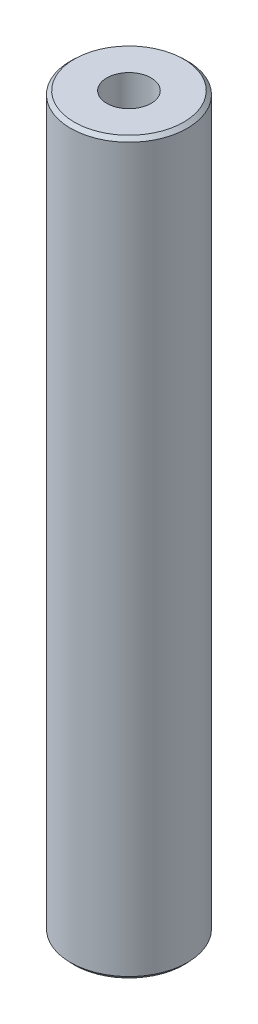
from build123d import *
from OCP.BRepFilletAPI import BRepFilletAPI_MakeChamfer

# Parameters (mm, degrees)
SKETCH1_R           = 47.5
BOSS_EXTRUDE1_DEPTH = 593.664447053
SKETCH2_R           = 18.027375068
CUT_EXTRUDE1_DEPTH  = 598.452906675
CHAMFER1_SIZE       = 2.806428359
CHAMFER1_SIZE2      = 3.017994737


with BuildPart() as part:
    # Sketch1 → Boss-Extrude1 (new body)
    with BuildSketch(Plane(origin=(0, 0, 0), x_dir=(1, 0, 0), z_dir=(0, 1, 0))):
        Circle(SKETCH1_R)
    extrude(amount=BOSS_EXTRUDE1_DEPTH)

    # Sketch2 → Cut-Extrude1 (cut, through all)
    with BuildSketch(Plane(origin=(0, 0, 0), x_dir=(1, 0, 0), z_dir=(0, 1, 0))):
        Circle(SKETCH2_R)
    extrude(amount=CUT_EXTRUDE1_DEPTH, mode=Mode.SUBTRACT)

    # Chamfer1: one chamfer whose edges measure the first distance from different faces: ONE call of the kernel's chamfer builder (chamfer() names one face for all edges)
    chamfer1_edges_1 = [part.edges().sort_by_distance(p)[0] for p in [
        (-47.5, 593.664447053, 0),
    ]]
    chamfer1_side_1 = [part.faces().sort_by_distance(p)[0] for p in [
        (-47.5, 296.832223526, 0),
    ]]
    chamfer1_edges_2 = [part.edges().sort_by_distance(p)[0] for p in [
        (-47.5, 0, 0),
    ]]
    chamfer1_side_2 = [part.faces().sort_by_distance(p)[0] for p in [
        (-46.156497116, 0, 0),
    ]]
    chamfer1 = BRepFilletAPI_MakeChamfer(part.part.solid().wrapped)
    for e in chamfer1_edges_1:
        chamfer1.Add(CHAMFER1_SIZE, CHAMFER1_SIZE2, e.wrapped, chamfer1_side_1[0].wrapped)  # the first distance lies on this face
    for e in chamfer1_edges_2:
        chamfer1.Add(CHAMFER1_SIZE, CHAMFER1_SIZE2, e.wrapped, chamfer1_side_2[0].wrapped)  # the first distance lies on this face
    add(Compound.cast(chamfer1.Shape()), mode=Mode.REPLACE)


solid = part.part
